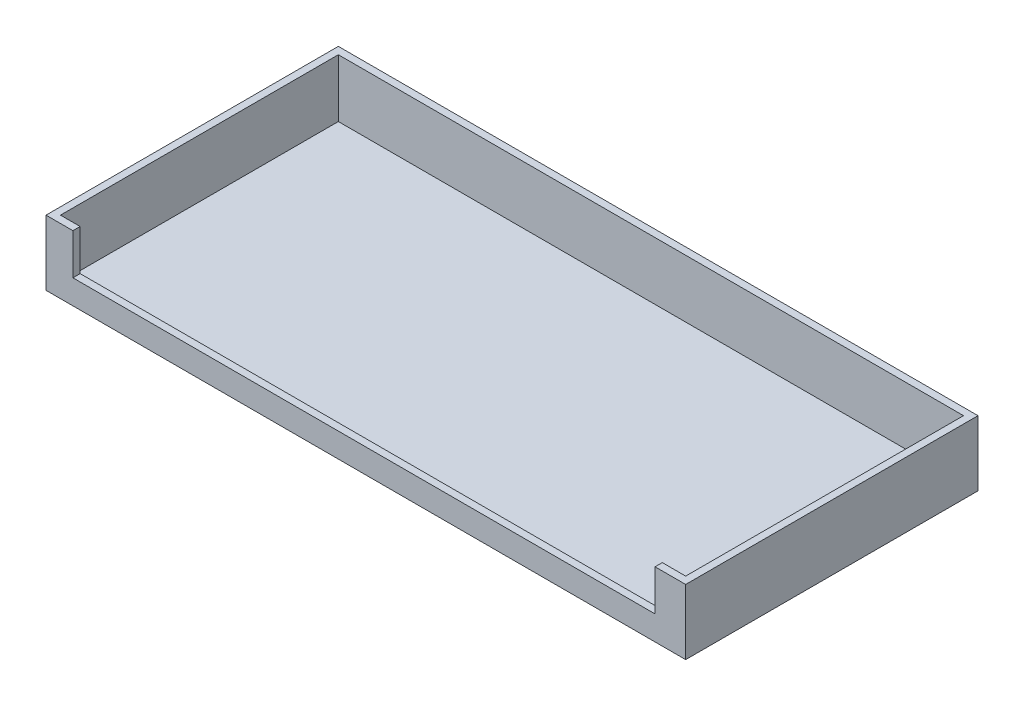
from build123d import *

# Parameters (mm, degrees)
SKETCH1_W           = 221
SKETCH1_H           = 101
SKETCH1_W_2         = 216
SKETCH1_H_2         = 96
BOSS_EXTRUDE1_DEPTH = 20
SKETCH1_3_W         = 221
SKETCH1_3_H         = 101
BOSS_EXTRUDE2_DEPTH = 2.5
SKETCH3_W           = 201.121255631
SKETCH3_H           = 14.10529534
CUT_EXTRUDE1_DEPTH  = 10


with BuildPart() as part:
    # Sketch1 → Boss-Extrude1 (new body)
    with BuildSketch(Plane(origin=(0, 0, 0), x_dir=(1, 0, 0), z_dir=(0, 1, 0))):
        Rectangle(SKETCH1_W, SKETCH1_H)
        Rectangle(SKETCH1_W_2, SKETCH1_H_2, mode=Mode.SUBTRACT)
    extrude(amount=BOSS_EXTRUDE1_DEPTH)

    # Sketch1<3> → Boss-Extrude2 (add)
    with BuildSketch(Plane(origin=(0, 0, 0), x_dir=(1, 0, 0), z_dir=(0, 1, 0))):
        Rectangle(SKETCH1_3_W, SKETCH1_3_H)
    extrude(amount=-BOSS_EXTRUDE2_DEPTH)

    # Sketch3 → Cut-Extrude1 (cut)
    with BuildSketch(Plane.XY.offset(50.5)):
        with Locations((-0.640205513, 12.94735233)):
            Rectangle(SKETCH3_W, SKETCH3_H)
    extrude(amount=-CUT_EXTRUDE1_DEPTH, mode=Mode.SUBTRACT)


solid = part.part
